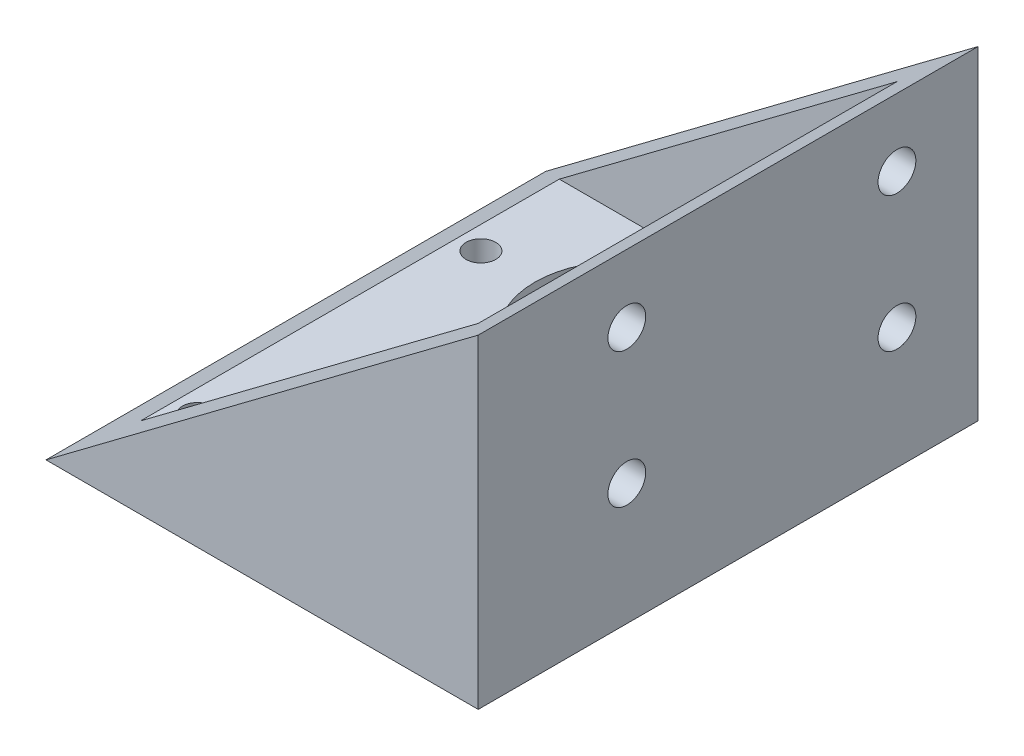
from build123d import *

# Parameters (mm, degrees)
EXTRUDE_1_DEPTH     = 37
SHELL_1_T           = -3
SKETCH_2_R          = 1.1
CUT_EXTRUDE_1_DEPTH = 30
SKETCH_3_R          = 6.5
CUT_EXTRUDE_2_DEPTH = 5
SKETCH_4_R          = 1.4
CUT_EXTRUDE_3_DEPTH = 5


with BuildPart() as part:
    # ｽｹｯﾁ1 → ﾎﾞｽ - 押し出し1 (new body)
    with BuildSketch(Plane.XY):
        Polygon((0, 0), (32, 0), (32, 24), align=None)
    extrude(amount=EXTRUDE_1_DEPTH)

    # ｼｪﾙ1
    shell_1_openings = [part.faces().sort_by_distance(p)[0] for p in [
        (16, 12, 18.5),
    ]]
    offset(amount=SHELL_1_T, openings=shell_1_openings, kind=Kind.INTERSECTION)

    # ｽｹｯﾁ2 → ｶｯﾄ - 押し出し1 (cut)
    with BuildSketch(Plane.XZ):
        with Locations((26.7, 10.5)):
            Circle(SKETCH_2_R)
        with Locations((5.7, 10.5)):
            Circle(SKETCH_2_R)
        with Locations((5.7, 31.5)):
            Circle(SKETCH_2_R)
        with Locations((26.7, 31.5)):
            Circle(SKETCH_2_R)
    extrude(amount=-CUT_EXTRUDE_1_DEPTH, mode=Mode.SUBTRACT)

    # ｽｹｯﾁ3 → ｶｯﾄ - 押し出し2 (cut)
    with BuildSketch(Plane.XZ):
        with Locations((16.2, 10.5)):
            Circle(SKETCH_3_R)
    extrude(amount=-CUT_EXTRUDE_2_DEPTH, mode=Mode.SUBTRACT)

    # ｽｹｯﾁ4 → ｶｯﾄ - 押し出し3 (cut)
    with BuildSketch(Plane(origin=(32, 0, 0), x_dir=(0, 0, -1), z_dir=(1, 0, 0))):
        with Locations((-6, 19)):
            Circle(SKETCH_4_R)
        with Locations((-26, 19)):
            Circle(SKETCH_4_R)
        with Locations((-26, 9)):
            Circle(SKETCH_4_R)
        with Locations((-6, 9)):
            Circle(SKETCH_4_R)
    extrude(amount=-CUT_EXTRUDE_3_DEPTH, mode=Mode.SUBTRACT)


solid = part.part
